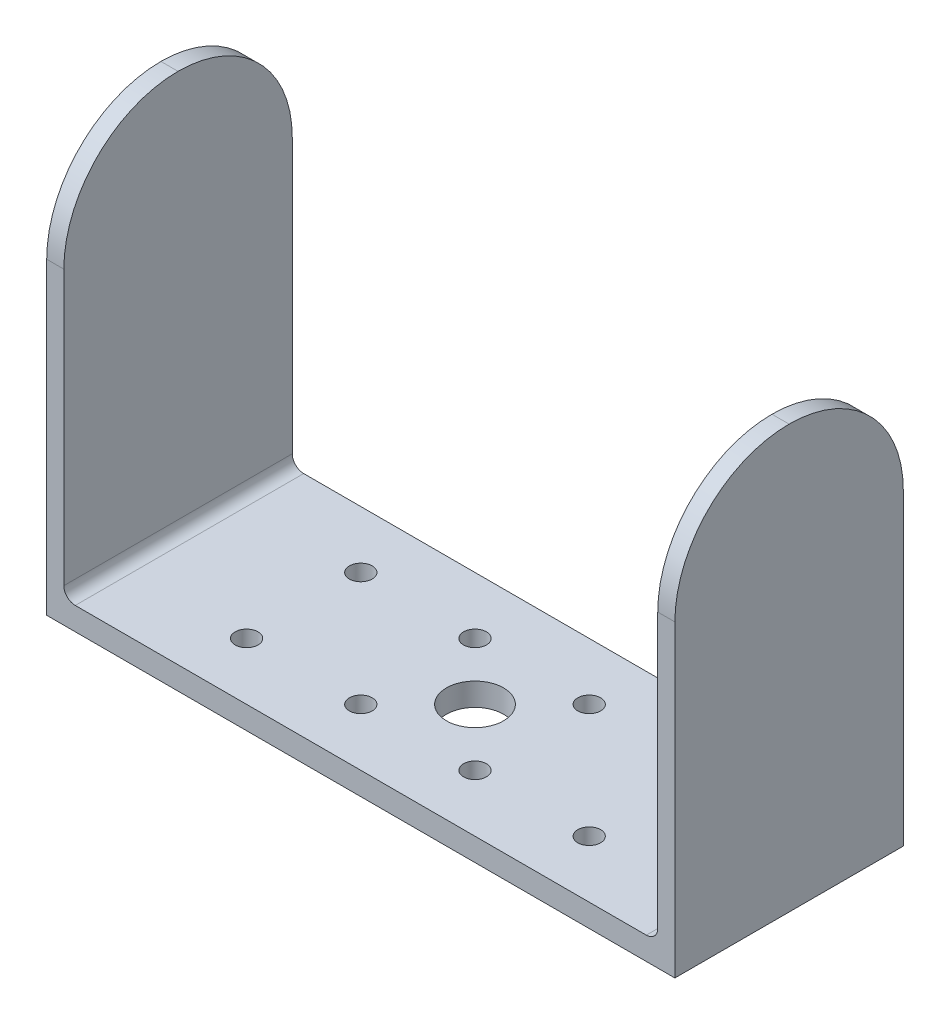
from build123d import *

# Parameters (mm, degrees)
SKETCH_1_W          = 55
SKETCH_1_H          = 20
EXTRUDE_1_DEPTH     = 2
SKETCH_3_W          = 1.5
SKETCH_3_H          = 20
EXTRUDE_2_DEPTH     = 35
FILLET_1_R          = 10
FILLET_3_R          = 1
CUT_EXTRUDE_1_REACH = 49.173
SKETCH_6_R          = 2.5
SKETCH_6_R_2        = 1


with BuildPart() as part:
    # 草图1 → 凸台-拉伸1 (new body)
    with BuildSketch(Plane(origin=(0, 0, 0), x_dir=(1, 0, 0), z_dir=(0, 1, 0))):
        Rectangle(SKETCH_1_W, SKETCH_1_H)
    extrude(amount=-EXTRUDE_1_DEPTH)

    # 草图3 → 凸台-拉伸2 (add)
    with BuildSketch(Plane(origin=(0, 0, 0), x_dir=(1, 0, 0), z_dir=(0, 1, 0))):
        with Locations((-26.75, 0)):
            Rectangle(SKETCH_3_W, SKETCH_3_H)
        with Locations((26.75, 0)):
            Rectangle(SKETCH_3_W, SKETCH_3_H)
    extrude(amount=EXTRUDE_2_DEPTH)

    # 圆角1
    fillet_1_edges = [part.edges().sort_by_distance(p)[0] for p in [
        (-26.75, 35, -10),
        (-26.75, 35, 10),
        (26.75, 35, 10),
        (26.75, 35, -10),
    ]]
    fillet(fillet_1_edges, radius=FILLET_1_R - 0.0001)  # a hair under: the kernel refuses the full size

    # 圆角3
    fillet_3_edges = [part.edges().sort_by_distance(p)[0] for p in [
        (-26, 0, 0),
        (26, 0, 0),
    ]]
    fillet(fillet_3_edges, radius=FILLET_3_R)

    # 草图6 → 切除-拉伸1 (cut, up to next)
    with BuildSketch(Plane.XZ.offset(2), mode=Mode.PRIVATE) as cut_extrude_1_sk1:
        with Locations(Location((0, 0, 0), (0, 0, 270))):
            Circle(SKETCH_6_R)
    cut_extrude_1_tool1 = extrude(cut_extrude_1_sk1.sketch, amount=-CUT_EXTRUDE_1_REACH, mode=Mode.PRIVATE) & part.part
    # 草图6 → 切除-拉伸1 (cut, up to next)
    with BuildSketch(Plane.XZ.offset(2), mode=Mode.PRIVATE) as cut_extrude_1_sk2:
        with Locations(Location((-5, 5, 0), (0, 0, 270))):
            Circle(SKETCH_6_R_2)
    cut_extrude_1_tool2 = extrude(cut_extrude_1_sk2.sketch, amount=-CUT_EXTRUDE_1_REACH, mode=Mode.PRIVATE) & part.part
    # 草图6 → 切除-拉伸1 (cut, up to next)
    with BuildSketch(Plane.XZ.offset(2), mode=Mode.PRIVATE) as cut_extrude_1_sk3:
        with Locations(Location((-5, -5, 0), (0, 0, 270))):
            Circle(SKETCH_6_R_2)
    cut_extrude_1_tool3 = extrude(cut_extrude_1_sk3.sketch, amount=-CUT_EXTRUDE_1_REACH, mode=Mode.PRIVATE) & part.part
    # 草图6 → 切除-拉伸1 (cut, up to next)
    with BuildSketch(Plane.XZ.offset(2), mode=Mode.PRIVATE) as cut_extrude_1_sk4:
        with Locations(Location((5, -5, 0), (0, 0, 270))):
            Circle(SKETCH_6_R_2)
    cut_extrude_1_tool4 = extrude(cut_extrude_1_sk4.sketch, amount=-CUT_EXTRUDE_1_REACH, mode=Mode.PRIVATE) & part.part
    # 草图6 → 切除-拉伸1 (cut, up to next)
    with BuildSketch(Plane.XZ.offset(2), mode=Mode.PRIVATE) as cut_extrude_1_sk5:
        with Locations(Location((5, 5, 0), (0, 0, 270))):
            Circle(SKETCH_6_R_2)
    cut_extrude_1_tool5 = extrude(cut_extrude_1_sk5.sketch, amount=-CUT_EXTRUDE_1_REACH, mode=Mode.PRIVATE) & part.part
    # 草图6 → 切除-拉伸1 (cut, up to next)
    with BuildSketch(Plane.XZ.offset(2), mode=Mode.PRIVATE) as cut_extrude_1_sk6:
        with Locations(Location((15, 5, 0), (0, 0, 270))):
            Circle(SKETCH_6_R_2)
    cut_extrude_1_tool6 = extrude(cut_extrude_1_sk6.sketch, amount=-CUT_EXTRUDE_1_REACH, mode=Mode.PRIVATE) & part.part
    # 草图6 → 切除-拉伸1 (cut, up to next)
    with BuildSketch(Plane.XZ.offset(2), mode=Mode.PRIVATE) as cut_extrude_1_sk7:
        with Locations(Location((-15, 5, 0), (0, 0, 90))):
            Circle(SKETCH_6_R_2)
    cut_extrude_1_tool7 = extrude(cut_extrude_1_sk7.sketch, amount=-CUT_EXTRUDE_1_REACH, mode=Mode.PRIVATE) & part.part
    # 草图6 → 切除-拉伸1 (cut, up to next)
    with BuildSketch(Plane.XZ.offset(2), mode=Mode.PRIVATE) as cut_extrude_1_sk8:
        with Locations(Location((15, -5, 0), (0, 0, 90))):
            Circle(SKETCH_6_R_2)
    cut_extrude_1_tool8 = extrude(cut_extrude_1_sk8.sketch, amount=-CUT_EXTRUDE_1_REACH, mode=Mode.PRIVATE) & part.part
    # 草图6 → 切除-拉伸1 (cut, up to next)
    with BuildSketch(Plane.XZ.offset(2), mode=Mode.PRIVATE) as cut_extrude_1_sk9:
        with Locations(Location((-15, -5, 0), (0, 0, 270))):
            Circle(SKETCH_6_R_2)
    cut_extrude_1_tool9 = extrude(cut_extrude_1_sk9.sketch, amount=-CUT_EXTRUDE_1_REACH, mode=Mode.PRIVATE) & part.part
    add(cut_extrude_1_tool1.solids().sort_by_distance((0, -2, 0))[0], mode=Mode.SUBTRACT)
    add(cut_extrude_1_tool2.solids().sort_by_distance((-5, -2, 5))[0], mode=Mode.SUBTRACT)
    add(cut_extrude_1_tool3.solids().sort_by_distance((-5, -2, -5))[0], mode=Mode.SUBTRACT)
    add(cut_extrude_1_tool4.solids().sort_by_distance((5, -2, -5))[0], mode=Mode.SUBTRACT)
    add(cut_extrude_1_tool5.solids().sort_by_distance((5, -2, 5))[0], mode=Mode.SUBTRACT)
    add(cut_extrude_1_tool6.solids().sort_by_distance((15, -2, 5))[0], mode=Mode.SUBTRACT)
    add(cut_extrude_1_tool7.solids().sort_by_distance((-15, -2, 5))[0], mode=Mode.SUBTRACT)
    add(cut_extrude_1_tool8.solids().sort_by_distance((15, -2, -5))[0], mode=Mode.SUBTRACT)
    add(cut_extrude_1_tool9.solids().sort_by_distance((-15, -2, -5))[0], mode=Mode.SUBTRACT)


solid = part.part
